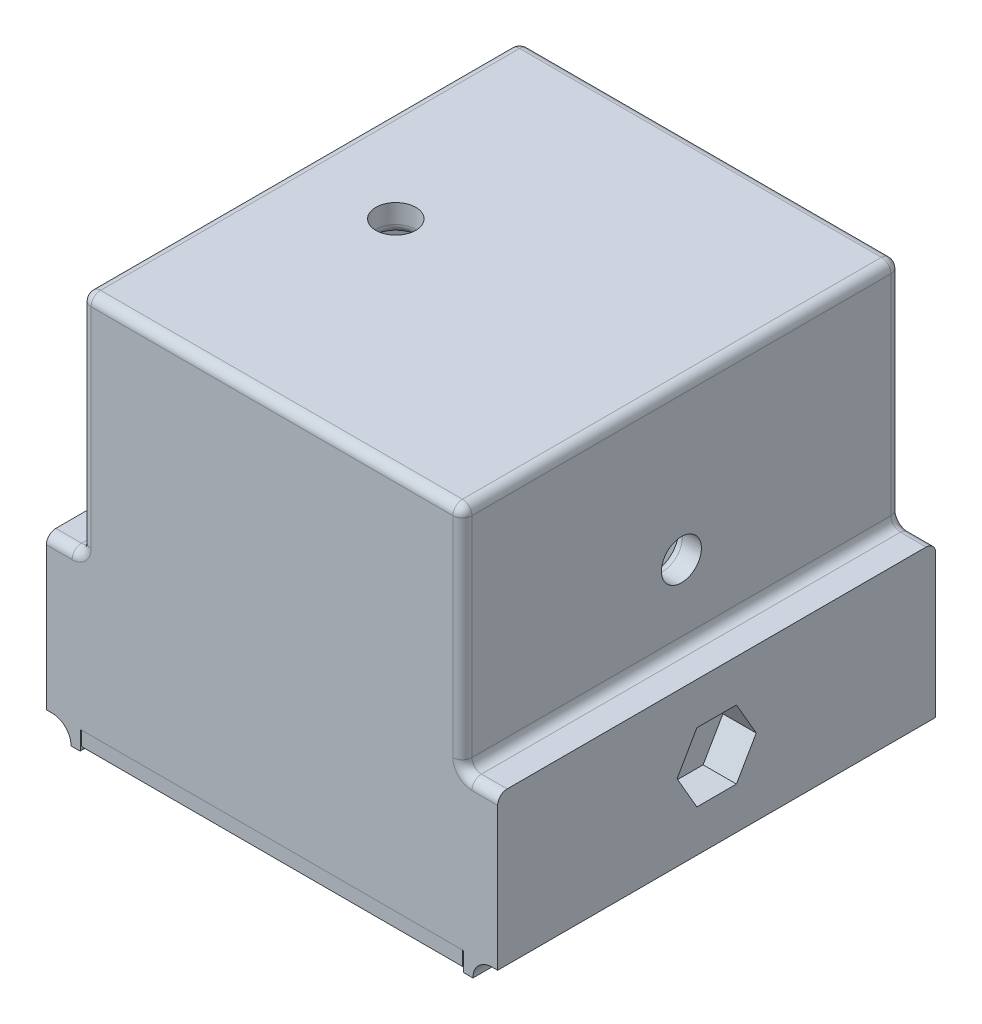
from build123d import *

# Parameters (mm, degrees)
SKETCH1_W               = 40
SKETCH1_H               = 46
BODY_DEPTH              = 40
SKETCH2_W               = 3.7
SKETCH2_H               = 46
EXTENSION_DEPTH         = 16
SKETCH5_W               = 34
SKETCH5_H               = 40
CAVITY_DEPTH            = 37
TOP_HOLE_REACH          = 53.872
SKETCH6_R               = 2.1
SIDE_HOLE_REACH         = 65.551
SKETCH7_R               = 2.1
SKETCH3_W               = 1
SKETCH3_H               = 46
LEGS_DEPTH              = 2
MOUNT_COUNTERBORE_DEPTH = 3.5
F_2MM_LEG_FILLET_R      = 2
F_0_1MM_LEG_FILLET_R    = 0.1
OUTER_BOUNDARY_FILLET_R = 1
INNER_BOUNDARY_FILLET_R = 1
SKETCH8_W               = 40
SKETCH8_H               = 46
BOSS_EXTRUDE1_DEPTH     = 1.5


with BuildPart() as part:
    # Sketch1 → Body (new body)
    with BuildSketch(Plane(origin=(0, 0, 0), x_dir=(1, 0, 0), z_dir=(0, 1, 0))):
        Rectangle(SKETCH1_W, SKETCH1_H)
    extrude(amount=BODY_DEPTH)

    # Sketch2 → Extension (add)
    with BuildSketch(Plane(origin=(0, 0, 0), x_dir=(1, 0, 0), z_dir=(0, 1, 0))):
        with Locations((-21.85, 0)):
            Rectangle(SKETCH2_W, SKETCH2_H)
        with Locations((21.85, 0)):
            Rectangle(SKETCH2_W, SKETCH2_H)
    extrude(amount=EXTENSION_DEPTH)

    # Sketch5 → Cavity (cut)
    with BuildSketch(Plane(origin=(0, 0, 0), x_dir=(1, 0, 0), z_dir=(0, 1, 0))):
        Rectangle(SKETCH5_W, SKETCH5_H)
    extrude(amount=CAVITY_DEPTH, mode=Mode.SUBTRACT)

    # Sketch6 → Top Hole (cut, up to next)
    with BuildSketch(Plane(origin=(0, 40, 0), x_dir=(1, 0, 0), z_dir=(0, 1, 0)), mode=Mode.PRIVATE) as top_hole_sk1:
        with Locations(Location((-10, 0, 0), (0, 0, 270))):
            Circle(SKETCH6_R)
    top_hole_tool1 = extrude(top_hole_sk1.sketch, amount=-TOP_HOLE_REACH, mode=Mode.PRIVATE) & part.part
    add(top_hole_tool1.solids().sort_by_distance((-10, 40, 0))[0], mode=Mode.SUBTRACT)

    # Sketch7 → Side Hole (cut, up to next)
    with BuildSketch(Plane(origin=(20, 0, 0), x_dir=(0, 0, -1), z_dir=(1, 0, 0)), mode=Mode.PRIVATE) as side_hole_sk1:
        with Locations((0, 24)):
            Circle(SKETCH7_R)
    side_hole_tool1 = extrude(side_hole_sk1.sketch, amount=-SIDE_HOLE_REACH, mode=Mode.PRIVATE) & part.part
    add(side_hole_tool1.solids().sort_by_distance((20, 24, 0))[0], mode=Mode.SUBTRACT)

    # Sketch3 → Legs (add)
    with BuildSketch(Plane(origin=(0, 0, 0), x_dir=(1, 0, 0), z_dir=(0, 1, 0))):
        with Locations((-20.6, 0)):
            Rectangle(SKETCH3_W, SKETCH3_H)
        with Locations((20.6, 0)):
            Rectangle(SKETCH3_W, SKETCH3_H)
    extrude(amount=-LEGS_DEPTH)

    # Sketch4 → Mount Counterbore (cut)
    with BuildSketch(Plane.ZY.offset(23.7)):
        Polygon((2.078460969, 11.6), (-2.078460969, 11.6), (-4.156921938, 8), (-2.078460969, 4.4), (2.078460969, 4.4), (4.156921938, 8), align=None)
    mount_counterbore = extrude(amount=-MOUNT_COUNTERBORE_DEPTH, mode=Mode.SUBTRACT)

    # Mount Counterbore Mirror: Mount Counterbore across plane
    add(mount_counterbore.mirror(Plane(origin=(0, 0, 0), x_dir=(0, 0, 1), z_dir=(1, 0, 0))), mode=Mode.SUBTRACT)

    # 2mm Leg Fillet
    f_2mm_leg_fillet_edges = [part.edges().sort_by_distance(p)[0] for p in [
        (21.1, 0, 0),
        (-21.1, 0, 0),
    ]]
    fillet(f_2mm_leg_fillet_edges, radius=F_2MM_LEG_FILLET_R - 0.0001)  # a hair under: the kernel refuses the full size

    # 0.1mm Leg Fillet
    f_0_1mm_leg_fillet_edges = [part.edges().sort_by_distance(p)[0] for p in [
        (-20.1, -2, 0),
        (-20.1, 0, 0),
        (20.1, -2, 0),
        (20.1, 0, 0),
    ]]
    fillet(f_0_1mm_leg_fillet_edges, radius=F_0_1MM_LEG_FILLET_R)

    # Outer Boundary Fillet
    outer_boundary_fillet_edges = [part.edges().sort_by_distance(p)[0] for p in [
        (20, 40, 0),
        (-20, 16, 0),
        (-21.85, 16, -23),
        (0, 40, -23),
        (-21.85, 16, 23),
        (20, 16, 0),
        (21.85, 16, 23),
        (21.85, 16, -23),
        (-20, 40, 0),
        (-20, 28, -23),
        (20, 28, -23),
        (20, 28, 23),
        (-20, 28, 23),
        (0, 40, 23),
    ]]
    fillet(outer_boundary_fillet_edges, radius=OUTER_BOUNDARY_FILLET_R)

    # Inner Boundary Fillet
    inner_boundary_fillet_edges = [part.edges().sort_by_distance(p)[0] for p in [
        (-17, 18.5, -20),
        (-17, 18.5, 20),
        (17, 18.5, 20),
        (17, 18.5, -20),
        (-17, 37, 0),
        (0, 37, 20),
        (17, 37, 0),
        (0, 37, -20),
        (-10, 37, -2.1),
        (17, 24, 2.1),
    ]]
    fillet(inner_boundary_fillet_edges, radius=INNER_BOUNDARY_FILLET_R)


with BuildPart() as body_2:
    # Sketch8 → Boss-Extrude1 (new body)
    with BuildSketch(Plane.XZ):
        Rectangle(SKETCH8_W, SKETCH8_H)
        with BuildLine():
            Line((-16, -20), (16, -20))
            ThreePointArc((16, -20), (16.707106781, -19.707106781), (17, -19))
            Line((17, -19), (17, 19))
            ThreePointArc((17, 19), (16.707106781, 19.707106781), (16, 20))
            Line((16, 20), (-16, 20))
            ThreePointArc((-16, 20), (-16.707106781, 19.707106781), (-17, 19))
            Line((-17, 19), (-17, -19))
            ThreePointArc((-17, -19), (-16.707106781, -19.707106781), (-16, -20))
        make_face(mode=Mode.SUBTRACT)
    extrude(amount=BOSS_EXTRUDE1_DEPTH)


solid = Compound([part.part, body_2.part])
